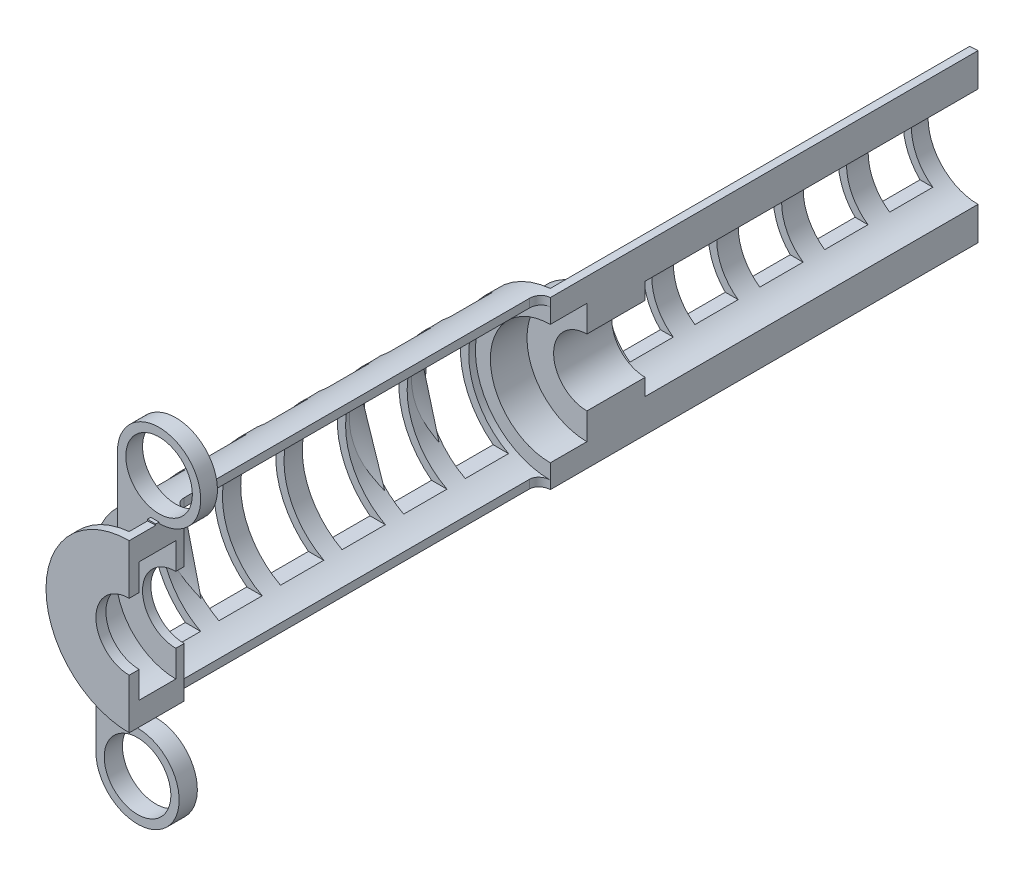
from build123d import *

# Parameters (mm, degrees)
BOSS_EXTRUDE2_DEPTH     = 51
SKETCH4_W               = 2
SKETCH4_H               = 3.5
SKETCH4_W_2             = 1.6
SKETCH4_H_2             = 2.2
SKETCH4_H_3             = 22
SKETCH4_H_4             = 0.5
SKETCH4_H_5             = 0.6
CUT_EXTRUDE1_DEPTH      = 52.487862647
CUT_EXTRUDE1_DEPTH_BACK = 52.487862647
SHELL1_DEPTH            = 23
SHELL1_START            = 48.2
SHELL1_2_DEPTH          = 2.3
SHELL1_START_2          = 23
SHELL1_3_DEPTH          = 2.2
SHELL1_START_3          = 20.5
SHELL1_4_DEPTH          = 2.5
CUT_EXTRUDE2_DEPTH      = 52.487862766
CUT_EXTRUDE2_DEPTH_BACK = 52.487862766
SKETCH11_3_W            = 2.6
SKETCH11_3_H            = 7.949874372
SKETCH11_3_H_2          = 4.92820323
BOSS_EXTRUDE3_START     = -1.206049
SKETCH13_R              = 2.5
SKETCH13_R_2            = 2
BOSS_EXTRUDE3_DEPTH     = 1.206049
SKETCH13_3_R            = 2.5
SKETCH13_3_R_2          = 2
BOSS_EXTRUDE4_DEPTH     = 1.093951
CUT_EXTRUDE3_START      = -0.2
SKETCH13_6_R            = 2.5
SKETCH13_6_R_2          = 2
CUT_EXTRUDE3_DEPTH      = 0.2
CUT_EXTRUDE4_START      = -0.2
SKETCH13_7_R            = 2.5
SKETCH13_7_R_2          = 2
CUT_EXTRUDE4_DEPTH      = 0.2
SKETCH16_W              = 0.218836676
SKETCH16_H              = 0.970663166
SKETCH16_W_2            = 0.2
SKETCH16_H_2            = 1.122183611
BOSS_EXTRUDE10_DEPTH    = 0.5


# Read off the part's stored shape, not the designer's step: Shell1
with BuildPart() as part:
    # Sketch1 → Boss-Extrude2 (new body)
    with BuildSketch(Plane.XY):
        with BuildLine():
            Line((0, 5), (0, -5))
            ThreePointArc((0, -5), (-5, 0), (0, 5))
        make_face()
    extrude(amount=BOSS_EXTRUDE2_DEPTH)

    # Sketch4 → Cut-Revolve1 (revolve, cut)
    with BuildSketch(Plane(origin=(0, 0, 0), x_dir=(1, 0, 0), z_dir=(0, 1, 0))):
        Polygon((-3, 0), (-3, -20), (-2, -20), (0, -20), (0, 0), align=None)
        with Locations((-1, -21.75)):
            Rectangle(SKETCH4_W, SKETCH4_H)
        with Locations((-2.8, -24.6)):
            Rectangle(SKETCH4_W_2, SKETCH4_H_2)
        with Locations((-1, -24.6)):
            Rectangle(SKETCH4_W, SKETCH4_H_2)
        Polygon((-2, -47.7), (-2, -25.7), (-3.6, -25.7), (-4.5, -25.7), (-4.5, -47.7), align=None)
        with Locations((-1, -36.7)):
            Rectangle(SKETCH4_W, SKETCH4_H_3)
        with Locations((-1, -47.95)):
            Rectangle(SKETCH4_W, SKETCH4_H_4)
        with Locations((-2.8, -49.3)):
            Rectangle(SKETCH4_W_2, SKETCH4_H_2)
        with Locations((-1, -49.3)):
            Rectangle(SKETCH4_W, SKETCH4_H_2)
        with Locations((-1, -50.7)):
            Rectangle(SKETCH4_W, SKETCH4_H_5)
    revolve(axis=Axis((0, 0, 0), (0, 0, 1)), mode=Mode.SUBTRACT)

    # Sketch5 → Cut-Extrude1 (cut, two sides: drawn at the far end of the back side and taken through both)
    with BuildSketch(Plane(origin=(0, 0, 0), x_dir=(1, 0, 0), z_dir=(0, 1, 0)).offset(-CUT_EXTRUDE1_DEPTH_BACK)):
        with BuildLine():
            Line((0.625, -26.325), (0.625, -47.075))
            ThreePointArc((0.625, -47.075), (0, -47.7), (-0.625, -47.075))
            Line((-0.625, -47.075), (-0.625, -26.325))
            ThreePointArc((-0.625, -26.325), (0, -25.7), (0.625, -26.325))
        make_face()
    extrude(amount=CUT_EXTRUDE1_DEPTH + CUT_EXTRUDE1_DEPTH_BACK, mode=Mode.SUBTRACT)

    # Shell1 outline → Shell1 (cut)
    with BuildSketch(Plane.XY):
        with BuildLine():
            ThreePointArc((-0.5, -3.464101615), (-3.5, 0), (-0.5, 3.464101615))
            Line((-0.5, 3.464101615), (-0.5, 4.974937186))
            ThreePointArc((-0.5, 4.974937186), (-5, 0), (-0.5, -4.974937186))
            Line((-0.5, -4.974937186), (-0.5, -3.464101615))
        make_face()
    extrude(amount=SHELL1_DEPTH, mode=Mode.SUBTRACT)

    # Shell1 2 outline → Shell1 2 (cut)
    with BuildSketch(Plane.XY.offset(SHELL1_START)):
        with BuildLine():
            Line((-0.5, -4.974937186), (-0.5, -4.06939799))
            ThreePointArc((-0.5, -4.06939799), (-4.1, 0), (-0.5, 4.06939799))
            Line((-0.5, 4.06939799), (-0.5, 4.974937186))
            ThreePointArc((-0.5, 4.974937186), (-5, 0), (-0.5, -4.974937186))
        make_face()
    extrude(amount=SHELL1_2_DEPTH, mode=Mode.SUBTRACT)

    # Shell1 3 outline → Shell1 3 (cut)
    with BuildSketch(Plane.XY.offset(SHELL1_START_2)):
        with BuildLine():
            Line((-0.5, -4.974937186), (-0.5, -4.06939799))
            ThreePointArc((-0.5, -4.06939799), (-4.1, 0), (-0.5, 4.06939799))
            Line((-0.5, 4.06939799), (-0.5, 4.974937186))
            ThreePointArc((-0.5, 4.974937186), (-5, 0), (-0.5, -4.974937186))
        make_face()
    extrude(amount=SHELL1_3_DEPTH, mode=Mode.SUBTRACT)

    # Shell1 4 outline → Shell1 4 (cut)
    with BuildSketch(Plane.XY.offset(SHELL1_START_3)):
        with BuildLine():
            Line((-0.5, -3.464101615), (-0.5, -2.449489743))
            ThreePointArc((-0.5, -2.449489743), (-2.5, 0), (-0.5, 2.449489743))
            Line((-0.5, 2.449489743), (-0.5, 3.464101615))
            ThreePointArc((-0.5, 3.464101615), (-3.5, 0), (-0.5, -3.464101615))
        make_face()
    extrude(amount=SHELL1_4_DEPTH, mode=Mode.SUBTRACT)

    # Sketch11<3> → Cut-Extrude2 (cut, two sides: drawn at the far end of the back side and taken through both)
    with BuildSketch(Plane.ZY.offset(5).offset(-CUT_EXTRUDE2_DEPTH_BACK)):
        with Locations((27.4, 0)):
            Rectangle(SKETCH11_3_W, SKETCH11_3_H)
        with Locations((34.8, 0)):
            Rectangle(SKETCH11_3_W, SKETCH11_3_H)
        with Locations((38.5, 0)):
            Rectangle(SKETCH11_3_W, SKETCH11_3_H)
        with Locations((42.2, 0)):
            Rectangle(SKETCH11_3_W, SKETCH11_3_H)
        with Locations((45.9, 0)):
            Rectangle(SKETCH11_3_W, SKETCH11_3_H)
        with Locations((2.3, 0)):
            Rectangle(SKETCH11_3_W, SKETCH11_3_H_2)
        with Locations((6.2, 0)):
            Rectangle(SKETCH11_3_W, SKETCH11_3_H_2)
        with Locations((10.1, 0)):
            Rectangle(SKETCH11_3_W, SKETCH11_3_H_2)
        with Locations((14, 0)):
            Rectangle(SKETCH11_3_W, SKETCH11_3_H_2)
        with Locations((17.9, 0)):
            Rectangle(SKETCH11_3_W, SKETCH11_3_H_2)
        with Locations((31.1, 0)):
            Rectangle(SKETCH11_3_W, SKETCH11_3_H)
    extrude(amount=CUT_EXTRUDE2_DEPTH + CUT_EXTRUDE2_DEPTH_BACK, mode=Mode.SUBTRACT)

    # Sketch13 → Boss-Extrude3 (add)
    # profile 1 of 2: a face of its own
    with BuildSketch(Plane.XY.offset(49.40604876).offset(BOSS_EXTRUDE3_START)):
        with Locations((0, 7.5)):
            Circle(SKETCH13_R)
        with Locations((0, 7.5)):
            Circle(SKETCH13_R_2, mode=Mode.SUBTRACT)
    # profile 2 of 2: a face of its own
    with BuildSketch(Plane.XY.offset(49.40604876).offset(BOSS_EXTRUDE3_START)):
        with BuildLine():
            Line((0, 4.1), (0, 5))
            ThreePointArc((0, 5), (-1.767766953, 5.732233047), (-2.5, 7.5))
            Line((-2.5, 7.5), (-2.5, 3.249615362))
            ThreePointArc((-2.5, 3.249615362), (-1.320336513, 3.881586208), (0, 4.1))
        make_face()
    extrude(amount=BOSS_EXTRUDE3_DEPTH)

    # Sketch13<3> → Boss-Extrude4 (add)
    # profile 1 of 2: a face of its own
    with BuildSketch(Plane.XY.offset(49.40604876)):
        with Locations((0, -7.5)):
            Circle(SKETCH13_3_R)
        with Locations(Location((0, -7.5, 0), (0, 0, 180))):
            Circle(SKETCH13_3_R_2, mode=Mode.SUBTRACT)
    # profile 2 of 2: a face of its own
    with BuildSketch(Plane.XY.offset(49.40604876)):
        with BuildLine():
            ThreePointArc((-2.5, -7.5), (-1.767766953, -5.732233047), (0, -5))
            Line((0, -5), (0, -4.1))
            ThreePointArc((0, -4.1), (-1.320336513, -3.881586208), (-2.5, -3.249615362))
            Line((-2.5, -3.249615362), (-2.5, -7.5))
        make_face()
    extrude(amount=BOSS_EXTRUDE4_DEPTH)

    # Sketch13<6> → Cut-Extrude3 (cut)
    # profile 1 of 2: a face of its own
    with BuildSketch(Plane.XY.offset(49.40604876).offset(CUT_EXTRUDE3_START)):
        with BuildLine():
            Line((0, 4.1), (0, 5))
            ThreePointArc((0, 5), (-1.767766953, 5.732233047), (-2.5, 7.5))
            Line((-2.5, 7.5), (-2.5, 3.249615362))
            ThreePointArc((-2.5, 3.249615362), (-1.320336513, 3.881586208), (0, 4.1))
        make_face()
    # profile 2 of 2: a face of its own
    with BuildSketch(Plane.XY.offset(49.40604876).offset(CUT_EXTRUDE3_START)):
        with Locations((0, 7.5)):
            Circle(SKETCH13_6_R)
        with Locations((0, 7.5)):
            Circle(SKETCH13_6_R_2, mode=Mode.SUBTRACT)
    extrude(amount=CUT_EXTRUDE3_DEPTH, mode=Mode.SUBTRACT)

    # Sketch13<7> → Cut-Extrude4 (cut)
    # profile 1 of 2: a face of its own
    with BuildSketch(Plane.XY.offset(49.40604876).offset(CUT_EXTRUDE4_START)):
        with Locations((0, -7.5)):
            Circle(SKETCH13_7_R)
        with Locations(Location((0, -7.5, 0), (0, 0, 180))):
            Circle(SKETCH13_7_R_2, mode=Mode.SUBTRACT)
    # profile 2 of 2: a face of its own
    with BuildSketch(Plane.XY.offset(49.40604876).offset(CUT_EXTRUDE4_START)):
        with BuildLine():
            ThreePointArc((-2.5, -7.5), (-1.767766953, -5.732233047), (0, -5))
            Line((0, -5), (0, -4.1))
            ThreePointArc((0, -4.1), (-1.320336513, -3.881586208), (-2.5, -3.249615362))
            Line((-2.5, -3.249615362), (-2.5, -7.5))
        make_face()
    extrude(amount=CUT_EXTRUDE4_DEPTH, mode=Mode.SUBTRACT)

    # Sketch16 → Boss-Extrude10 (add)
    with BuildSketch(Plane(origin=(0, 0, 0), x_dir=(0, 0, -1), z_dir=(1, 0, 0))):
        with Locations((-49.315467098, -4.514668417)):
            Rectangle(SKETCH16_W, SKETCH16_H)
        with Locations((-49.30604876, 4.509747926)):
            Rectangle(SKETCH16_W_2, SKETCH16_H_2)
    extrude(amount=-BOSS_EXTRUDE10_DEPTH)


solid = part.part
